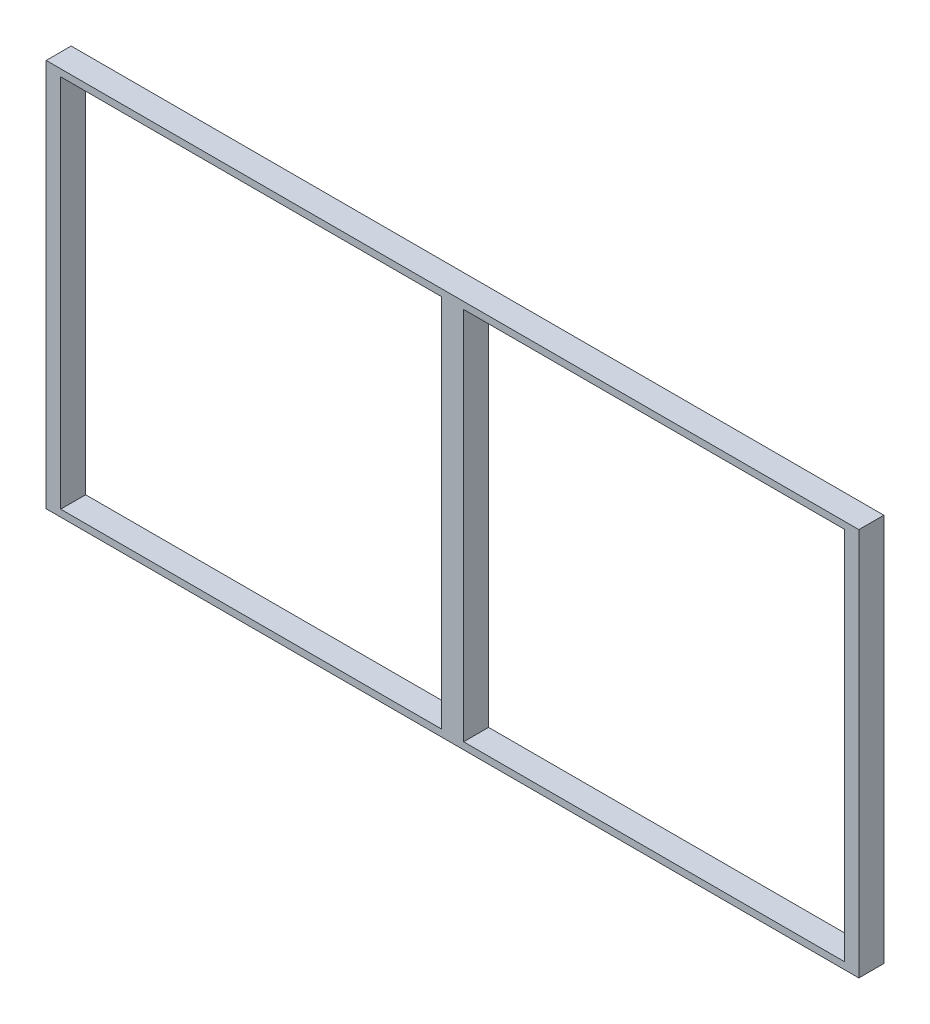
from build123d import *

# Parameters (mm, degrees)
SKETCH_1_W      = 5860
SKETCH_1_H      = 2800
SKETCH_1_W_2    = 2745.357142857
SKETCH_1_H_2    = 2700
EXTRUDE_1_DEPTH = 180


with BuildPart() as part:
    # Эскиз1 → Бобышка-Вытянуть1 (new body)
    with BuildSketch(Plane.XY):
        Rectangle(SKETCH_1_W, SKETCH_1_H)
        with Locations((-1452.678571429, 0)):
            Rectangle(SKETCH_1_W_2, SKETCH_1_H_2, mode=Mode.SUBTRACT)
        with Locations((1452.678571429, 0)):
            Rectangle(SKETCH_1_W_2, SKETCH_1_H_2, mode=Mode.SUBTRACT)
    extrude(amount=EXTRUDE_1_DEPTH)


solid = part.part
